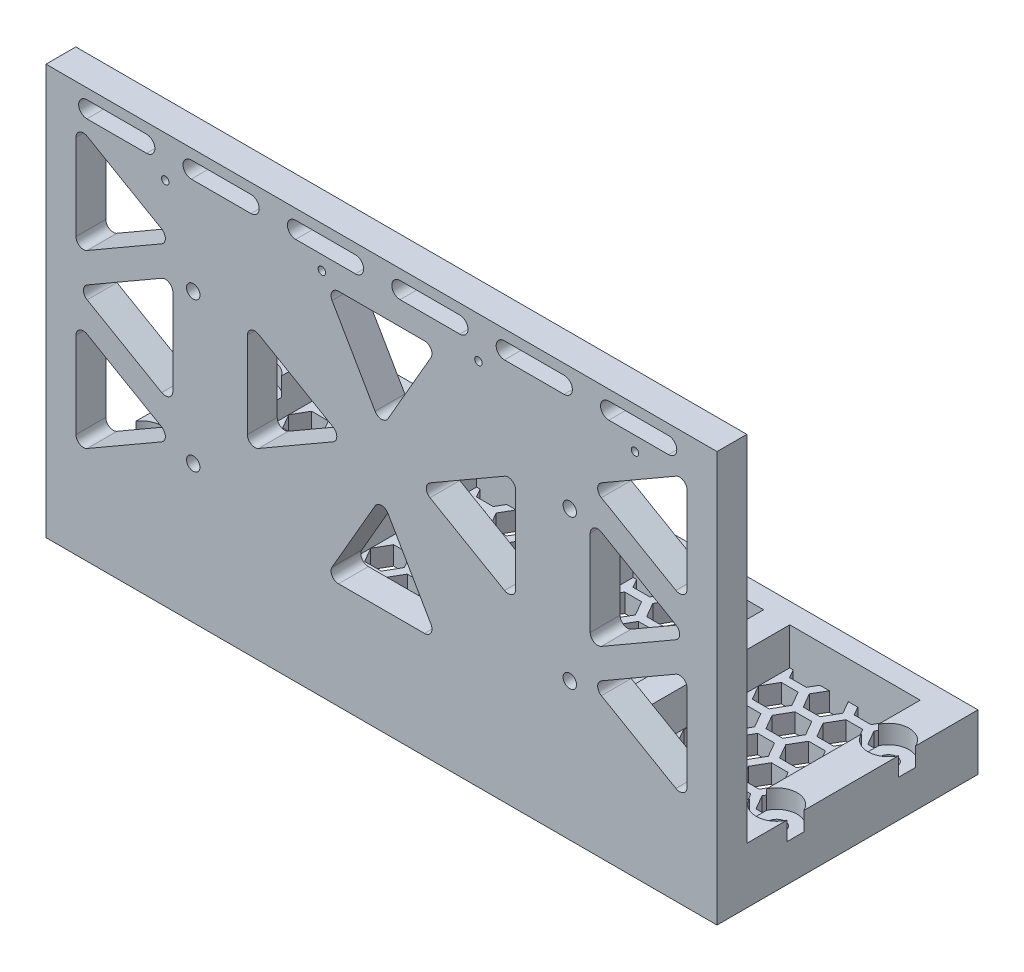
from build123d import *

# Parameters (mm, degrees)
SKETCH1_W           = 180
SKETCH1_H           = 70
BOSS_EXTRUDE1_DEPTH = 15
SKETCH2_W           = 35
SKETCH2_H           = 56.5
CUT_EXTRUDE1_DEPTH  = 10
BOSS_EXTRUDE2_DEPTH = 4
LPATTERN1_COUNT     = 4
LPATTERN1_PITCH     = 42
SKETCH5_W           = 180
SKETCH5_H           = 8
BOSS_EXTRUDE3_DEPTH = 95
SKETCH6_R           = 1.8
CUT_EXTRUDE2_DEPTH  = 223.261107709
CHAMFER1_SIZE       = 2
CUT_EXTRUDE3_DEPTH  = 85
FILLET1_R           = 2
SKETCH10_R          = 1
CUT_EXTRUDE5_DEPTH  = 220.872690437
LPATTERN3_COUNT     = 4
LPATTERN3_PITCH     = 42
SKETCH11_R          = 5.5
CUT_EXTRUDE6_DEPTH  = 5
SKETCH12_R          = 2.25
CUT_EXTRUDE7_DEPTH  = 10
CUT_EXTRUDE8_DEPTH  = 220.82947937
LPATTERN4_COUNT     = 4
LPATTERN4_PITCH     = 42
CUT_EXTRUDE9_DEPTH  = 223.261107709
LPATTERN5_COUNT     = 6
LPATTERN5_PITCH     = 28


with BuildPart() as part:
    # Sketch1 → Boss-Extrude1 (new body)
    with BuildSketch(Plane(origin=(0, 0, 0), x_dir=(1, 0, 0), z_dir=(0, 1, 0))):
        with Locations((90, 35)):
            Rectangle(SKETCH1_W, SKETCH1_H)
    extrude(amount=BOSS_EXTRUDE1_DEPTH)

    # Sketch2 → Cut-Extrude1 (cut)
    with BuildSketch(Plane(origin=(0, 15, 0), x_dir=(1, 0, 0), z_dir=(0, 1, 0))):
        with Locations((152.5, 36.25)):
            Rectangle(SKETCH2_W, SKETCH2_H)
    cut_extrude1 = extrude(amount=-CUT_EXTRUDE1_DEPTH, mode=Mode.SUBTRACT)

    # Sketch4 → Boss-Extrude2 (add)
    with BuildSketch(Plane(origin=(0, 0, -8), x_dir=(-1, 0, 0), z_dir=(0, 0, -1))):
        with BuildLine():
            Line((-160.25, 8.75), (-160.25, 5))
            Line((-160.25, 5), (-155.75, 5))
            Line((-155.75, 5), (-155.75, 8.75))
            ThreePointArc((-155.75, 8.75), (-158, 11), (-160.25, 8.75))
        make_face()
    boss_extrude2 = extrude(amount=BOSS_EXTRUDE2_DEPTH)

    # LPattern1: Cut-Extrude1, Boss-Extrude2 ×4
    with Locations(*[(-i * LPATTERN1_PITCH, 0, 0) for i in range(1, LPATTERN1_COUNT)]):
        add(cut_extrude1, mode=Mode.SUBTRACT)
        add(boss_extrude2)

    # Sketch5 → Boss-Extrude3 (add)
    with BuildSketch(Plane(origin=(0, 15, 0), x_dir=(1, 0, 0), z_dir=(0, 1, 0))):
        with Locations((90, 4)):
            Rectangle(SKETCH5_W, SKETCH5_H)
    extrude(amount=BOSS_EXTRUDE3_DEPTH)

    # Sketch6 → Cut-Extrude2 (cut, through all)
    with BuildSketch(Plane.XY):
        with Locations((39.5, 76.970798769)):
            Circle(SKETCH6_R)
        with Locations((140.5, 76.970798769)):
            Circle(SKETCH6_R)
        with Locations((39.5, 36.970798769)):
            Circle(SKETCH6_R)
        with Locations((140.5, 36.970798769)):
            Circle(SKETCH6_R)
    extrude(amount=-CUT_EXTRUDE2_DEPTH, mode=Mode.SUBTRACT)

    # Chamfer1
    chamfer1_edges = [part.edges().sort_by_distance(p)[0] for p in [
        (37.7, 76.970798769, -8),
        (138.7, 36.970798769, -8),
        (138.7, 76.970798769, -8),
        (37.7, 36.970798769, -8),
    ]]
    chamfer(chamfer1_edges, length=CHAMFER1_SIZE)

    # Sketch8 → Cut-Extrude3 (cut)
    with BuildSketch(Plane(origin=(0, 0, -8), x_dir=(-1, 0, 0), z_dir=(0, 0, -1))):
        Polygon((-145.980762114, 77.5), (-171.961524227, 62.5), (-145.980762114, 47.5), align=None)
        Polygon((-171.961524227, 100.5), (-171.961524227, 70.5), (-145.980762114, 85.5), align=None)
        Polygon((-171.961524227, 24.5), (-171.961524227, 54.5), (-145.980762114, 39.5), align=None)
        Polygon((-125.980762114, 47.5), (-125.980762114, 77.5), (-100, 62.5), align=None)
        Polygon((-75, 96.480762114), (-90, 70.5), (-105, 96.480762114), align=None)
        Polygon((-54.019237886, 47.5), (-54.019237886, 77.5), (-80, 62.5), align=None)
        Polygon((-105, 28.519237886), (-75, 28.519237886), (-90, 54.5), align=None)
        Polygon((-8.038475773, 54.5), (-8.038475773, 24.5), (-34.019237886, 39.5), align=None)
        Polygon((-34.019237886, 47.5), (-34.019237886, 77.5), (-8.038475773, 62.5), align=None)
        Polygon((-8.038475773, 70.5), (-8.038475773, 100.5), (-34.019237886, 85.5), align=None)
    extrude(amount=-CUT_EXTRUDE3_DEPTH, mode=Mode.SUBTRACT)

    # Fillet1
    fillet1_edges = [part.edges().sort_by_distance(p)[0] for p in [
        (8.038475773, 54.5, -4),
        (8.038475773, 24.5, -4),
        (34.019237886, 39.5, -4),
        (34.019237886, 47.5, -4),
        (34.019237886, 77.5, -4),
        (8.038475773, 62.5, -4),
        (54.019237886, 77.5, -4),
        (54.019237886, 47.5, -4),
        (80, 62.5, -4),
        (75, 28.519237886, -4),
        (105, 28.519237886, -4),
        (90, 54.5, -4),
        (125.980762114, 47.5, -4),
        (125.980762114, 77.5, -4),
        (100, 62.5, -4),
        (75, 96.480762114, -4),
        (90, 70.5, -4),
        (105, 96.480762114, -4),
        (171.961524227, 24.5, -4),
        (171.961524227, 54.5, -4),
        (145.980762114, 39.5, -4),
        (171.961524227, 70.5, -4),
        (171.961524227, 100.5, -4),
        (145.980762114, 85.5, -4),
        (8.038475773, 100.5, -4),
        (8.038475773, 70.5, -4),
        (34.019237886, 85.5, -4),
        (171.961524227, 62.5, -4),
        (145.980762114, 77.5, -4),
        (145.980762114, 47.5, -4),
    ]]
    fillet(fillet1_edges, radius=FILLET1_R)

    # Sketch10 → Cut-Extrude5 (cut, through all)
    with BuildSketch(Plane(origin=(0, 0, -8), x_dir=(-1, 0, 0), z_dir=(0, 0, -1))):
        with Locations((-158, 99)):
            Circle(SKETCH10_R)
    cut_extrude5 = extrude(amount=-CUT_EXTRUDE5_DEPTH, mode=Mode.SUBTRACT)

    # LPattern3: Cut-Extrude5 ×4
    with Locations(*[(-i * LPATTERN3_PITCH, 0, 0) for i in range(1, LPATTERN3_COUNT)]):
        add(cut_extrude5, mode=Mode.SUBTRACT)

    # Sketch11 → Cut-Extrude6 (cut)
    with BuildSketch(Plane(origin=(0, 15, 0), x_dir=(1, 0, 0), z_dir=(0, 1, 0))):
        with Locations((175, 51)):
            Circle(SKETCH11_R)
        with Locations((175, 21)):
            Circle(SKETCH11_R)
        with Locations((4.5, 21)):
            Circle(SKETCH11_R)
        with Locations((4.5, 51)):
            Circle(SKETCH11_R)
    extrude(amount=-CUT_EXTRUDE6_DEPTH, mode=Mode.SUBTRACT)

    # Sketch12 → Cut-Extrude7 (cut)
    with BuildSketch(Plane(origin=(0, 10, 0), x_dir=(1, 0, 0), z_dir=(0, 1, 0))):
        with Locations(Location((4.5, 51, 0), (0, 0, 270))):
            Circle(SKETCH12_R)
        with Locations(Location((4.5, 21, 0), (0, 0, 270))):
            Circle(SKETCH12_R)
        with Locations(Location((175, 51, 0), (0, 0, 270))):
            Circle(SKETCH12_R)
        with Locations(Location((175, 21, 0), (0, 0, 270))):
            Circle(SKETCH12_R)
    extrude(amount=-CUT_EXTRUDE7_DEPTH, mode=Mode.SUBTRACT)

    # Sketch9 → Cut-Extrude8 (cut, through all)
    with BuildSketch(Plane(origin=(0, 5, 0), x_dir=(1, 0, 0), z_dir=(0, 1, 0))):
        Polygon((11.25, -10), (15.75, -10), (18, -13.897114317), (15.75, -17.794228634), (11.25, -17.794228634), (9, -13.897114317), align=None)
        Polygon((11.25, 10), (15.75, 10), (16.904700538, 8), (10.095299462, 8), align=None)
        Polygon((11.25, 20), (15.75, 20), (18, 16.102885683), (15.75, 12.205771366), (11.25, 12.205771366), (9, 16.102885683), align=None)
        Polygon((11.25, 30), (15.75, 30), (18, 26.102885683), (15.75, 22.205771366), (11.25, 22.205771366), (9, 26.102885683), align=None)
        Polygon((11.25, 40), (15.75, 40), (18, 36.102885683), (15.75, 32.205771366), (11.25, 32.205771366), (9, 36.102885683), align=None)
        Polygon((11.25, 50), (15.75, 50), (18, 46.102885683), (15.75, 42.205771366), (11.25, 42.205771366), (9, 46.102885683), align=None)
        Polygon((11.25, 60), (15.75, 60), (18, 56.102885683), (15.75, 52.205771366), (11.25, 52.205771366), (9, 56.102885683), align=None)
        Polygon((17.074573519, 64.5), (15.75, 62.205771366), (11.25, 62.205771366), (9.925426481, 64.5), align=None)
        Polygon((19.910254038, 15), (24.410254038, 15), (26.660254038, 11.102885683), (24.868802154, 8), (19.451705922, 8), (17.660254038, 11.102885683), align=None)
        Polygon((19.910254038, 25), (24.410254038, 25), (26.660254038, 21.102885683), (24.410254038, 17.205771366), (19.910254038, 17.205771366), (17.660254038, 21.102885683), align=None)
        Polygon((19.910254038, 35), (24.410254038, 35), (26.660254038, 31.102885683), (24.410254038, 27.205771366), (19.910254038, 27.205771366), (17.660254038, 31.102885683), align=None)
        Polygon((19.910254038, 45), (24.410254038, 45), (26.660254038, 41.102885683), (24.410254038, 37.205771366), (19.910254038, 37.205771366), (17.660254038, 41.102885683), align=None)
        Polygon((19.910254038, 55), (24.410254038, 55), (26.660254038, 51.102885683), (24.410254038, 47.205771366), (19.910254038, 47.205771366), (17.660254038, 51.102885683), align=None)
        Polygon((24.698929172, 64.5), (26.660254038, 61.102885683), (24.410254038, 57.205771366), (19.910254038, 57.205771366), (17.660254038, 61.102885683), (19.621578903, 64.5), align=None)
        Polygon((28.570508076, 20), (33.070508076, 20), (35.320508076, 16.102885683), (33.070508076, 12.205771366), (28.570508076, 12.205771366), (26.320508076, 16.102885683), align=None)
        Polygon((28.570508076, 30), (33.070508076, 30), (35.320508076, 26.102885683), (33.070508076, 22.205771366), (28.570508076, 22.205771366), (26.320508076, 26.102885683), align=None)
        Polygon((28.570508076, 40), (33.070508076, 40), (35.320508076, 36.102885683), (33.070508076, 32.205771366), (28.570508076, 32.205771366), (26.320508076, 36.102885683), align=None)
        Polygon((28.570508076, 50), (33.070508076, 50), (35.320508076, 46.102885683), (33.070508076, 42.205771366), (28.570508076, 42.205771366), (26.320508076, 46.102885683), align=None)
        Polygon((28.570508076, 60), (33.070508076, 60), (35.320508076, 56.102885683), (33.070508076, 52.205771366), (28.570508076, 52.205771366), (26.320508076, 56.102885683), align=None)
        Polygon((34.395081595, 64.5), (33.070508076, 62.205771366), (28.570508076, 62.205771366), (27.245934556, 64.5), align=None)
        Polygon((37.230762114, 15), (41.730762114, 15), (43.980762114, 11.102885683), (42.189310229, 8), (36.772213998, 8), (34.980762114, 11.102885683), align=None)
        Polygon((37.230762114, 25), (41.730762114, 25), (43.980762114, 21.102885683), (41.730762114, 17.205771366), (37.230762114, 17.205771366), (34.980762114, 21.102885683), align=None)
        Polygon((37.230762114, 35), (41.730762114, 35), (43.980762114, 31.102885683), (41.730762114, 27.205771366), (37.230762114, 27.205771366), (34.980762114, 31.102885683), align=None)
        Polygon((37.230762114, 45), (41.730762114, 45), (43.980762114, 41.102885683), (41.730762114, 37.205771366), (37.230762114, 37.205771366), (34.980762114, 41.102885683), align=None)
        Polygon((37.230762114, 55), (41.730762114, 55), (43.980762114, 51.102885683), (41.730762114, 47.205771366), (37.230762114, 47.205771366), (34.980762114, 51.102885683), align=None)
        Polygon((42.019437248, 64.5), (43.980762114, 61.102885683), (41.730762114, 57.205771366), (37.230762114, 57.205771366), (34.980762114, 61.102885683), (36.942086979, 64.5), align=None)
    cut_extrude8 = extrude(amount=-CUT_EXTRUDE8_DEPTH, mode=Mode.SUBTRACT)

    # LPattern4: Cut-Extrude8 ×4
    with Locations(*[(i * LPATTERN4_PITCH, 0, 0) for i in range(1, LPATTERN4_COUNT)]):
        add(cut_extrude8, mode=Mode.SUBTRACT)

    # Sketch13 → Cut-Extrude9 (cut, through all)
    with BuildSketch(Plane.XY):
        with BuildLine():
            Line((10.975926704, 107.219626284), (26.975926704, 107.219626284))
            ThreePointArc((26.975926704, 107.219626284), (29.195552988, 105), (26.975926704, 102.780373716))
            Line((26.975926704, 102.780373716), (10.975926704, 102.780373716))
            ThreePointArc((10.975926704, 102.780373716), (8.75630042, 105), (10.975926704, 107.219626284))
        make_face()
    cut_extrude9 = extrude(amount=-CUT_EXTRUDE9_DEPTH, mode=Mode.SUBTRACT)

    # LPattern5: Cut-Extrude9 ×6
    with Locations(*[(i * LPATTERN5_PITCH, 0, 0) for i in range(1, LPATTERN5_COUNT)]):
        add(cut_extrude9, mode=Mode.SUBTRACT)


solid = part.part
